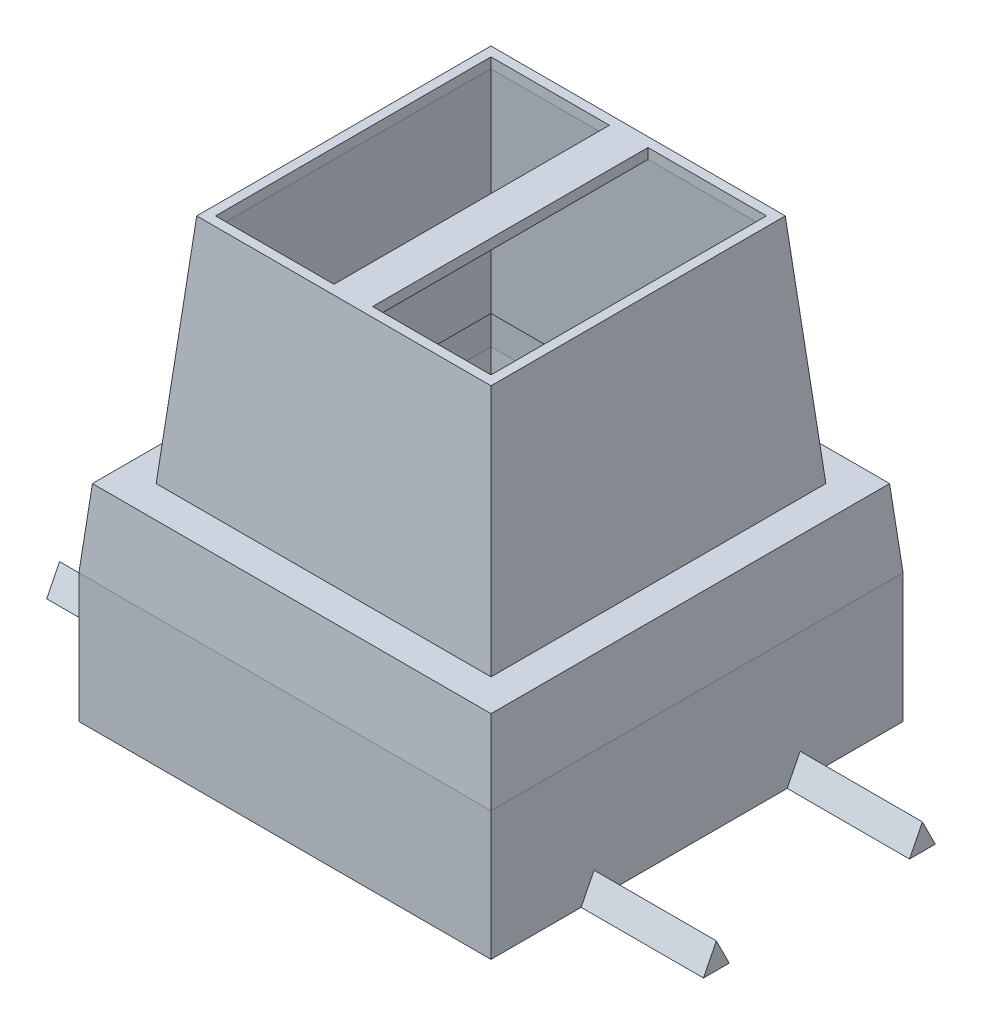
from build123d import *

# Parameters (mm, degrees)
SKETCH1_W           = 32
SKETCH1_H           = 32
BOSS_EXTRUDE1_DEPTH = 6
BOSS_EXTRUDE1_TAPER = 5
SKETCH2_W           = 26
SKETCH2_H           = 26
BOSS_EXTRUDE2_DEPTH = 18
BOSS_EXTRUDE2_TAPER = 5
SHELL1_T            = -0.8
CHAMFER1_SIZE       = 2.5
CHAMFER1_SIZE_2     = 2.750157169
SKETCH3_W           = 9.192139117
SKETCH3_H           = 21.384278234
CUT_EXTRUDE1_DEPTH  = 51.855088412
SKETCH4_W           = 32
SKETCH4_H           = 32
SKETCH4_W_2         = 30.39388826
SKETCH4_H_2         = 30.39388826
BOSS_EXTRUDE3_DEPTH = 10
BOSS_EXTRUDE4_DEPTH = 9.5
BOSS_EXTRUDE5_START = -32
BOSS_EXTRUDE5_DEPTH = 9.5


with BuildPart() as part:
    # Sketch1 → Boss-Extrude1 (new body)
    with BuildSketch(Plane(origin=(0, 0, 0), x_dir=(1, 0, 0), z_dir=(0, 1, 0))):
        with Locations((-16, 16)):
            Rectangle(SKETCH1_W, SKETCH1_H)
    extrude(amount=BOSS_EXTRUDE1_DEPTH, taper=BOSS_EXTRUDE1_TAPER)

    # Sketch2 → Boss-Extrude2 (add)
    with BuildSketch(Plane(origin=(0, 6, 0), x_dir=(1, 0, 0), z_dir=(0, 1, 0))):
        with Locations((-16, 16)):
            Rectangle(SKETCH2_W, SKETCH2_H)
    extrude(amount=BOSS_EXTRUDE2_DEPTH, taper=BOSS_EXTRUDE2_TAPER)

    # Shell1
    shell1_openings = [part.faces().sort_by_distance(p)[0] for p in [
        (-16, 0, -16),
    ]]
    offset(amount=SHELL1_T, openings=shell1_openings, kind=Kind.INTERSECTION)

    # Chamfer1
    # the kernel refuses this chamfer: 2.750157169, 2.5 mm, written as the material it adds along each edge
    with BuildSketch(Plane(origin=(5.830274952, 5.2, -1.25799692), x_dir=(0, 0.030161850139926293, -0.9995450278982617), z_dir=(-1, 0, 0))) as chamfer1_piece_1_section:
        Polygon((CHAMFER1_SIZE * 0.999545027898, CHAMFER1_SIZE * 0.0301618501399), (-CHAMFER1_SIZE_2 * 0.117163164513, CHAMFER1_SIZE_2 * 0.993112678869), (0, 0), align=None)
    chamfer1_piece_1 = extrude(amount=43.660549905, mode=Mode.PRIVATE)
    chamfer1_piece_1 = split(chamfer1_piece_1, bisect_by=Plane(origin=(-1.2737044, 5.379537315, -3.779154262), z_dir=(-0.9961946980917455, -0.08715574274765792, 0)), keep=Keep.TOP, mode=Mode.PRIVATE)
    chamfer1_piece_1 = split(chamfer1_piece_1, bisect_by=Plane(origin=(-3.729971497, 5.164641789, -3.779154262), z_dir=(0.9961946980917455, 0.08715574274765821, 0)), keep=Keep.TOP, mode=Mode.PRIVATE)
    chamfer1_piece_1 = split(chamfer1_piece_1, bisect_by=Plane(origin=(-2.501837948, 5.275543614, -3.739674149), z_dir=(0, -0.08715574274765829, -0.9961946980917455)), keep=Keep.TOP, mode=Mode.PRIVATE)
    add(chamfer1_piece_1)
    with BuildSketch(Plane(origin=(5.830274952, 5.2, -1.25799692), x_dir=(0, 0.030161850139926293, -0.9995450278982617), z_dir=(-1, 0, 0))) as chamfer1_piece_2_section:
        Polygon((CHAMFER1_SIZE * 0.999545027898, CHAMFER1_SIZE * 0.0301618501399), (-CHAMFER1_SIZE_2 * 0.117163164513, CHAMFER1_SIZE_2 * 0.993112678869), (0, 0), align=None)
    chamfer1_piece_2 = extrude(amount=43.660549905, mode=Mode.PRIVATE)
    chamfer1_piece_2 = split(chamfer1_piece_2, bisect_by=Plane(origin=(-1.187972058, 4.399612159, -1.99521412), z_dir=(-0.9961946980917455, -0.08715574274765792, 0)), keep=Keep.TOP, mode=Mode.PRIVATE)
    chamfer1_piece_2 = split(chamfer1_piece_2, bisect_by=Plane(origin=(-3.644239154, 4.184716633, -1.99521412), z_dir=(0.9961946980917455, 0.08715574274765821, 0)), keep=Keep.TOP, mode=Mode.PRIVATE)
    chamfer1_piece_2 = split(chamfer1_piece_2, bisect_by=Plane(origin=(-2.416105606, 4.148173113, -3.641042011), z_dir=(0, 0.08715574274765829, 0.9961946980917455)), keep=Keep.TOP, mode=Mode.PRIVATE)
    add(chamfer1_piece_2)
    with BuildSketch(Plane(origin=(5.830274952, 5.2, -1.25799692), x_dir=(0, 0.030161850139926293, -0.9995450278982617), z_dir=(-1, 0, 0))) as chamfer1_piece_3_section:
        Polygon((CHAMFER1_SIZE * 0.999545027898, CHAMFER1_SIZE * 0.0301618501399), (-CHAMFER1_SIZE_2 * 0.117163164513, CHAMFER1_SIZE_2 * 0.993112678869), (0, 0), align=None)
    chamfer1_piece_3 = extrude(amount=43.660549905, mode=Mode.PRIVATE)
    chamfer1_piece_3 = split(chamfer1_piece_3, bisect_by=Plane(origin=(-3.747130429, 5.360769289, -1.993289961), z_dir=(-0.9961946980917455, -0.08715574274765821, 0)), keep=Keep.TOP, mode=Mode.PRIVATE)
    chamfer1_piece_3 = split(chamfer1_piece_3, bisect_by=Plane(origin=(-16, 4.144649452, -3.64073373), z_dir=(0, 0.08715574274765829, 0.9961946980917455)), keep=Keep.TOP, mode=Mode.PRIVATE)
    chamfer1_piece_3 = split(chamfer1_piece_3, bisect_by=Plane(origin=(-28.252869571, 5.360769289, -1.993289961), z_dir=(0.9961946980917455, -0.08715574274765829, 0)), keep=Keep.TOP, mode=Mode.PRIVATE)
    add(chamfer1_piece_3)
    with BuildSketch(Plane(origin=(5.830274952, 5.2, -1.25799692), x_dir=(0, 0.030161850139926293, -0.9995450278982617), z_dir=(-1, 0, 0))) as chamfer1_piece_4_section:
        Polygon((CHAMFER1_SIZE * 0.999545027898, CHAMFER1_SIZE * 0.0301618501399), (-CHAMFER1_SIZE_2 * 0.117163164513, CHAMFER1_SIZE_2 * 0.993112678869), (0, 0), align=None)
    chamfer1_piece_4 = extrude(amount=43.660549905, mode=Mode.PRIVATE)
    chamfer1_piece_4 = split(chamfer1_piece_4, bisect_by=Plane(origin=(-29.498162052, 5.275543614, -3.739674149), z_dir=(0, -0.08715574274765829, -0.9961946980917455)), keep=Keep.TOP, mode=Mode.PRIVATE)
    chamfer1_piece_4 = split(chamfer1_piece_4, bisect_by=Plane(origin=(-28.270028503, 5.164641789, -3.779154262), z_dir=(-0.9961946980917455, 0.08715574274765829, 0)), keep=Keep.TOP, mode=Mode.PRIVATE)
    chamfer1_piece_4 = split(chamfer1_piece_4, bisect_by=Plane(origin=(-30.7262956, 5.379537315, -3.779154262), z_dir=(0.9961946980917455, -0.08715574274765851, 0)), keep=Keep.TOP, mode=Mode.PRIVATE)
    add(chamfer1_piece_4)
    with BuildSketch(Plane(origin=(5.830274952, 5.2, -1.25799692), x_dir=(0, 0.030161850139926293, -0.9995450278982617), z_dir=(-1, 0, 0))) as chamfer1_piece_5_section:
        Polygon((CHAMFER1_SIZE * 0.999545027898, CHAMFER1_SIZE * 0.0301618501399), (-CHAMFER1_SIZE_2 * 0.117163164513, CHAMFER1_SIZE_2 * 0.993112678869), (0, 0), align=None)
    chamfer1_piece_5 = extrude(amount=43.660549905, mode=Mode.PRIVATE)
    chamfer1_piece_5 = split(chamfer1_piece_5, bisect_by=Plane(origin=(-29.583894394, 4.148173113, -3.641042011), z_dir=(0, 0.08715574274765829, 0.9961946980917455)), keep=Keep.TOP, mode=Mode.PRIVATE)
    chamfer1_piece_5 = split(chamfer1_piece_5, bisect_by=Plane(origin=(-28.355760846, 4.184716633, -1.99521412), z_dir=(-0.9961946980917455, 0.08715574274765829, 0)), keep=Keep.TOP, mode=Mode.PRIVATE)
    chamfer1_piece_5 = split(chamfer1_piece_5, bisect_by=Plane(origin=(-30.812027942, 4.399612159, -1.99521412), z_dir=(0.9961946980917455, -0.08715574274765851, 0)), keep=Keep.TOP, mode=Mode.PRIVATE)
    add(chamfer1_piece_5)
    with BuildSketch(Plane(origin=(-30.74200308, 5.2, 5.830274952), x_dir=(0.9995450278982617, 0.030161850139926356, 0), z_dir=(0, 0, -1))) as chamfer1_piece_6_section:
        Polygon((CHAMFER1_SIZE * 0.999545027898, CHAMFER1_SIZE * 0.0301618501399), (-CHAMFER1_SIZE_2 * 0.117163164513, CHAMFER1_SIZE_2 * 0.993112678869), (0, 0), align=None)
    chamfer1_piece_6 = extrude(amount=43.660549905, mode=Mode.PRIVATE)
    chamfer1_piece_6 = split(chamfer1_piece_6, bisect_by=Plane(origin=(-28.220845738, 5.164641789, -3.729971497), z_dir=(0, 0.08715574274765829, 0.9961946980917455)), keep=Keep.TOP, mode=Mode.PRIVATE)
    chamfer1_piece_6 = split(chamfer1_piece_6, bisect_by=Plane(origin=(-28.260325851, 5.275543614, -2.501837948), z_dir=(0.9961946980917455, -0.08715574274765829, 0)), keep=Keep.TOP, mode=Mode.PRIVATE)
    chamfer1_piece_6 = split(chamfer1_piece_6, bisect_by=Plane(origin=(-28.220845738, 5.379537315, -1.2737044), z_dir=(0, -0.08715574274765792, -0.9961946980917455)), keep=Keep.TOP, mode=Mode.PRIVATE)
    add(chamfer1_piece_6)
    with BuildSketch(Plane(origin=(-30.74200308, 5.2, 5.830274952), x_dir=(0.9995450278982617, 0.030161850139926356, 0), z_dir=(0, 0, -1))) as chamfer1_piece_7_section:
        Polygon((CHAMFER1_SIZE * 0.999545027898, CHAMFER1_SIZE * 0.0301618501399), (-CHAMFER1_SIZE_2 * 0.117163164513, CHAMFER1_SIZE_2 * 0.993112678869), (0, 0), align=None)
    chamfer1_piece_7 = extrude(amount=43.660549905, mode=Mode.PRIVATE)
    chamfer1_piece_7 = split(chamfer1_piece_7, bisect_by=Plane(origin=(-30.00478588, 4.184716633, -3.644239154), z_dir=(0, 0.08715574274765829, 0.9961946980917455)), keep=Keep.TOP, mode=Mode.PRIVATE)
    chamfer1_piece_7 = split(chamfer1_piece_7, bisect_by=Plane(origin=(-28.358957989, 4.148173113, -2.416105606), z_dir=(-0.9961946980917455, 0.08715574274765829, 0)), keep=Keep.TOP, mode=Mode.PRIVATE)
    chamfer1_piece_7 = split(chamfer1_piece_7, bisect_by=Plane(origin=(-30.00478588, 4.399612159, -1.187972058), z_dir=(0, -0.08715574274765792, -0.9961946980917455)), keep=Keep.TOP, mode=Mode.PRIVATE)
    add(chamfer1_piece_7)
    with BuildSketch(Plane(origin=(-30.74200308, 5.2, 5.830274952), x_dir=(0.9995450278982617, 0.030161850139926356, 0), z_dir=(0, 0, -1))) as chamfer1_piece_8_section:
        Polygon((CHAMFER1_SIZE * 0.999545027898, CHAMFER1_SIZE * 0.0301618501399), (-CHAMFER1_SIZE_2 * 0.117163164513, CHAMFER1_SIZE_2 * 0.993112678869), (0, 0), align=None)
    chamfer1_piece_8 = extrude(amount=43.660549905, mode=Mode.PRIVATE)
    chamfer1_piece_8 = split(chamfer1_piece_8, bisect_by=Plane(origin=(-30.006710039, 5.360769289, -28.252869571), z_dir=(0, -0.08715574274765829, 0.9961946980917455)), keep=Keep.TOP, mode=Mode.PRIVATE)
    chamfer1_piece_8 = split(chamfer1_piece_8, bisect_by=Plane(origin=(-30.006710039, 5.360769289, -3.747130429), z_dir=(0, -0.08715574274765829, -0.9961946980917455)), keep=Keep.TOP, mode=Mode.PRIVATE)
    chamfer1_piece_8 = split(chamfer1_piece_8, bisect_by=Plane(origin=(-28.35926627, 4.144649452, -16), z_dir=(-0.9961946980917455, 0.08715574274765829, 0)), keep=Keep.TOP, mode=Mode.PRIVATE)
    add(chamfer1_piece_8)
    with BuildSketch(Plane(origin=(-30.74200308, 5.2, 5.830274952), x_dir=(0.9995450278982617, 0.030161850139926356, 0), z_dir=(0, 0, -1))) as chamfer1_piece_9_section:
        Polygon((CHAMFER1_SIZE * 0.999545027898, CHAMFER1_SIZE * 0.0301618501399), (-CHAMFER1_SIZE_2 * 0.117163164513, CHAMFER1_SIZE_2 * 0.993112678869), (0, 0), align=None)
    chamfer1_piece_9 = extrude(amount=43.660549905, mode=Mode.PRIVATE)
    chamfer1_piece_9 = split(chamfer1_piece_9, bisect_by=Plane(origin=(-28.220845738, 5.379537315, -30.7262956), z_dir=(0, -0.08715574274765836, 0.9961946980917455)), keep=Keep.TOP, mode=Mode.PRIVATE)
    chamfer1_piece_9 = split(chamfer1_piece_9, bisect_by=Plane(origin=(-28.220845738, 5.164641789, -28.270028503), z_dir=(0, 0.08715574274765829, -0.9961946980917455)), keep=Keep.TOP, mode=Mode.PRIVATE)
    chamfer1_piece_9 = split(chamfer1_piece_9, bisect_by=Plane(origin=(-28.260325851, 5.275543614, -29.498162052), z_dir=(0.9961946980917455, -0.08715574274765829, 0)), keep=Keep.TOP, mode=Mode.PRIVATE)
    add(chamfer1_piece_9)
    with BuildSketch(Plane(origin=(-30.74200308, 5.2, 5.830274952), x_dir=(0.9995450278982617, 0.030161850139926356, 0), z_dir=(0, 0, -1))) as chamfer1_piece_10_section:
        Polygon((CHAMFER1_SIZE * 0.999545027898, CHAMFER1_SIZE * 0.0301618501399), (-CHAMFER1_SIZE_2 * 0.117163164513, CHAMFER1_SIZE_2 * 0.993112678869), (0, 0), align=None)
    chamfer1_piece_10 = extrude(amount=43.660549905, mode=Mode.PRIVATE)
    chamfer1_piece_10 = split(chamfer1_piece_10, bisect_by=Plane(origin=(-30.00478588, 4.399612159, -30.812027942), z_dir=(0, -0.08715574274765836, 0.9961946980917455)), keep=Keep.TOP, mode=Mode.PRIVATE)
    chamfer1_piece_10 = split(chamfer1_piece_10, bisect_by=Plane(origin=(-30.00478588, 4.184716633, -28.355760846), z_dir=(0, 0.08715574274765829, -0.9961946980917455)), keep=Keep.TOP, mode=Mode.PRIVATE)
    chamfer1_piece_10 = split(chamfer1_piece_10, bisect_by=Plane(origin=(-28.358957989, 4.148173113, -29.583894394), z_dir=(-0.9961946980917455, 0.08715574274765829, 0)), keep=Keep.TOP, mode=Mode.PRIVATE)
    add(chamfer1_piece_10)
    with BuildSketch(Plane(origin=(5.830274952, 5.2, -30.74200308), x_dir=(0, -0.9937112432628153, -0.11197305485280758), z_dir=(-1, 0, 0))) as chamfer1_piece_11_section:
        Polygon((CHAMFER1_SIZE_2 * 0.99968896676, CHAMFER1_SIZE_2 * 0.0249393220908), (-CHAMFER1_SIZE * 0.111973054853, CHAMFER1_SIZE * 0.993711243263), (0, 0), align=None)
    chamfer1_piece_11 = extrude(amount=43.660549905, mode=Mode.PRIVATE)
    chamfer1_piece_11 = split(chamfer1_piece_11, bisect_by=Plane(origin=(-1.187972058, 4.399612159, -30.00478588), z_dir=(-0.9961946980917455, -0.08715574274765792, 0)), keep=Keep.TOP, mode=Mode.PRIVATE)
    chamfer1_piece_11 = split(chamfer1_piece_11, bisect_by=Plane(origin=(-2.416105606, 4.148173113, -28.358957989), z_dir=(0, 0.08715574274765829, -0.9961946980917455)), keep=Keep.TOP, mode=Mode.PRIVATE)
    chamfer1_piece_11 = split(chamfer1_piece_11, bisect_by=Plane(origin=(-3.644239154, 4.184716633, -30.00478588), z_dir=(0.9961946980917455, 0.08715574274765821, 0)), keep=Keep.TOP, mode=Mode.PRIVATE)
    add(chamfer1_piece_11)
    with BuildSketch(Plane(origin=(5.830274952, 5.2, -30.74200308), x_dir=(0, -0.9937112432628153, -0.11197305485280758), z_dir=(-1, 0, 0))) as chamfer1_piece_12_section:
        Polygon((CHAMFER1_SIZE_2 * 0.99968896676, CHAMFER1_SIZE_2 * 0.0249393220908), (-CHAMFER1_SIZE * 0.111973054853, CHAMFER1_SIZE * 0.993711243263), (0, 0), align=None)
    chamfer1_piece_12 = extrude(amount=43.660549905, mode=Mode.PRIVATE)
    chamfer1_piece_12 = split(chamfer1_piece_12, bisect_by=Plane(origin=(-1.2737044, 5.379537315, -28.220845738), z_dir=(-0.9961946980917455, -0.08715574274765792, 0)), keep=Keep.TOP, mode=Mode.PRIVATE)
    chamfer1_piece_12 = split(chamfer1_piece_12, bisect_by=Plane(origin=(-2.501837948, 5.275543614, -28.260325851), z_dir=(0, -0.08715574274765829, 0.9961946980917455)), keep=Keep.TOP, mode=Mode.PRIVATE)
    chamfer1_piece_12 = split(chamfer1_piece_12, bisect_by=Plane(origin=(-3.729971497, 5.164641789, -28.220845738), z_dir=(0.9961946980917455, 0.08715574274765821, 0)), keep=Keep.TOP, mode=Mode.PRIVATE)
    add(chamfer1_piece_12)
    with BuildSketch(Plane(origin=(5.830274952, 5.2, -30.74200308), x_dir=(0, -0.9937112432628153, -0.11197305485280758), z_dir=(-1, 0, 0))) as chamfer1_piece_13_section:
        Polygon((CHAMFER1_SIZE_2 * 0.99968896676, CHAMFER1_SIZE_2 * 0.0249393220908), (-CHAMFER1_SIZE * 0.111973054853, CHAMFER1_SIZE * 0.993711243263), (0, 0), align=None)
    chamfer1_piece_13 = extrude(amount=43.660549905, mode=Mode.PRIVATE)
    chamfer1_piece_13 = split(chamfer1_piece_13, bisect_by=Plane(origin=(-16, 4.144649452, -28.35926627), z_dir=(0, 0.08715574274765829, -0.9961946980917455)), keep=Keep.TOP, mode=Mode.PRIVATE)
    chamfer1_piece_13 = split(chamfer1_piece_13, bisect_by=Plane(origin=(-3.747130429, 5.360769289, -30.006710039), z_dir=(-0.9961946980917455, -0.08715574274765821, 0)), keep=Keep.TOP, mode=Mode.PRIVATE)
    chamfer1_piece_13 = split(chamfer1_piece_13, bisect_by=Plane(origin=(-28.252869571, 5.360769289, -30.006710039), z_dir=(0.9961946980917455, -0.08715574274765829, 0)), keep=Keep.TOP, mode=Mode.PRIVATE)
    add(chamfer1_piece_13)
    with BuildSketch(Plane(origin=(5.830274952, 5.2, -30.74200308), x_dir=(0, -0.9937112432628153, -0.11197305485280758), z_dir=(-1, 0, 0))) as chamfer1_piece_14_section:
        Polygon((CHAMFER1_SIZE_2 * 0.99968896676, CHAMFER1_SIZE_2 * 0.0249393220908), (-CHAMFER1_SIZE * 0.111973054853, CHAMFER1_SIZE * 0.993711243263), (0, 0), align=None)
    chamfer1_piece_14 = extrude(amount=43.660549905, mode=Mode.PRIVATE)
    chamfer1_piece_14 = split(chamfer1_piece_14, bisect_by=Plane(origin=(-30.812027942, 4.399612159, -30.00478588), z_dir=(0.9961946980917455, -0.08715574274765851, 0)), keep=Keep.TOP, mode=Mode.PRIVATE)
    chamfer1_piece_14 = split(chamfer1_piece_14, bisect_by=Plane(origin=(-29.583894394, 4.148173113, -28.358957989), z_dir=(0, 0.08715574274765829, -0.9961946980917455)), keep=Keep.TOP, mode=Mode.PRIVATE)
    chamfer1_piece_14 = split(chamfer1_piece_14, bisect_by=Plane(origin=(-28.355760846, 4.184716633, -30.00478588), z_dir=(-0.9961946980917455, 0.08715574274765829, 0)), keep=Keep.TOP, mode=Mode.PRIVATE)
    add(chamfer1_piece_14)
    with BuildSketch(Plane(origin=(5.830274952, 5.2, -30.74200308), x_dir=(0, -0.9937112432628153, -0.11197305485280758), z_dir=(-1, 0, 0))) as chamfer1_piece_15_section:
        Polygon((CHAMFER1_SIZE_2 * 0.99968896676, CHAMFER1_SIZE_2 * 0.0249393220908), (-CHAMFER1_SIZE * 0.111973054853, CHAMFER1_SIZE * 0.993711243263), (0, 0), align=None)
    chamfer1_piece_15 = extrude(amount=43.660549905, mode=Mode.PRIVATE)
    chamfer1_piece_15 = split(chamfer1_piece_15, bisect_by=Plane(origin=(-30.7262956, 5.379537315, -28.220845738), z_dir=(0.9961946980917455, -0.08715574274765851, 0)), keep=Keep.TOP, mode=Mode.PRIVATE)
    chamfer1_piece_15 = split(chamfer1_piece_15, bisect_by=Plane(origin=(-29.498162052, 5.275543614, -28.260325851), z_dir=(0, -0.08715574274765829, 0.9961946980917455)), keep=Keep.TOP, mode=Mode.PRIVATE)
    chamfer1_piece_15 = split(chamfer1_piece_15, bisect_by=Plane(origin=(-28.270028503, 5.164641789, -28.220845738), z_dir=(-0.9961946980917455, 0.08715574274765829, 0)), keep=Keep.TOP, mode=Mode.PRIVATE)
    add(chamfer1_piece_15)
    with BuildSketch(Plane(origin=(-1.25799692, 5.2, 5.830274952), x_dir=(0.11197305485280797, -0.9937112432628151, 0), z_dir=(0, 0, -1))) as chamfer1_piece_16_section:
        Polygon((CHAMFER1_SIZE_2 * 0.99968896676, CHAMFER1_SIZE_2 * 0.0249393220908), (-CHAMFER1_SIZE * 0.111973054853, CHAMFER1_SIZE * 0.993711243263), (0, 0), align=None)
    chamfer1_piece_16 = extrude(amount=43.660549905, mode=Mode.PRIVATE)
    chamfer1_piece_16 = split(chamfer1_piece_16, bisect_by=Plane(origin=(-1.99521412, 4.399612159, -1.187972058), z_dir=(0, -0.08715574274765792, -0.9961946980917455)), keep=Keep.TOP, mode=Mode.PRIVATE)
    chamfer1_piece_16 = split(chamfer1_piece_16, bisect_by=Plane(origin=(-3.641042011, 4.148173113, -2.416105606), z_dir=(0.9961946980917455, 0.08715574274765821, 0)), keep=Keep.TOP, mode=Mode.PRIVATE)
    chamfer1_piece_16 = split(chamfer1_piece_16, bisect_by=Plane(origin=(-1.99521412, 4.184716633, -3.644239154), z_dir=(0, 0.08715574274765829, 0.9961946980917455)), keep=Keep.TOP, mode=Mode.PRIVATE)
    add(chamfer1_piece_16)
    with BuildSketch(Plane(origin=(-1.25799692, 5.2, 5.830274952), x_dir=(0.11197305485280797, -0.9937112432628151, 0), z_dir=(0, 0, -1))) as chamfer1_piece_17_section:
        Polygon((CHAMFER1_SIZE_2 * 0.99968896676, CHAMFER1_SIZE_2 * 0.0249393220908), (-CHAMFER1_SIZE * 0.111973054853, CHAMFER1_SIZE * 0.993711243263), (0, 0), align=None)
    chamfer1_piece_17 = extrude(amount=43.660549905, mode=Mode.PRIVATE)
    chamfer1_piece_17 = split(chamfer1_piece_17, bisect_by=Plane(origin=(-3.779154262, 5.379537315, -1.2737044), z_dir=(0, -0.08715574274765792, -0.9961946980917455)), keep=Keep.TOP, mode=Mode.PRIVATE)
    chamfer1_piece_17 = split(chamfer1_piece_17, bisect_by=Plane(origin=(-3.739674149, 5.275543614, -2.501837948), z_dir=(-0.9961946980917455, -0.08715574274765821, 0)), keep=Keep.TOP, mode=Mode.PRIVATE)
    chamfer1_piece_17 = split(chamfer1_piece_17, bisect_by=Plane(origin=(-3.779154262, 5.164641789, -3.729971497), z_dir=(0, 0.08715574274765829, 0.9961946980917455)), keep=Keep.TOP, mode=Mode.PRIVATE)
    add(chamfer1_piece_17)
    with BuildSketch(Plane(origin=(-1.25799692, 5.2, 5.830274952), x_dir=(0.11197305485280797, -0.9937112432628151, 0), z_dir=(0, 0, -1))) as chamfer1_piece_18_section:
        Polygon((CHAMFER1_SIZE_2 * 0.99968896676, CHAMFER1_SIZE_2 * 0.0249393220908), (-CHAMFER1_SIZE * 0.111973054853, CHAMFER1_SIZE * 0.993711243263), (0, 0), align=None)
    chamfer1_piece_18 = extrude(amount=43.660549905, mode=Mode.PRIVATE)
    chamfer1_piece_18 = split(chamfer1_piece_18, bisect_by=Plane(origin=(-1.993289961, 5.360769289, -28.252869571), z_dir=(0, -0.08715574274765829, 0.9961946980917455)), keep=Keep.TOP, mode=Mode.PRIVATE)
    chamfer1_piece_18 = split(chamfer1_piece_18, bisect_by=Plane(origin=(-3.64073373, 4.144649452, -16), z_dir=(0.9961946980917455, 0.08715574274765821, 0)), keep=Keep.TOP, mode=Mode.PRIVATE)
    chamfer1_piece_18 = split(chamfer1_piece_18, bisect_by=Plane(origin=(-1.993289961, 5.360769289, -3.747130429), z_dir=(0, -0.08715574274765829, -0.9961946980917455)), keep=Keep.TOP, mode=Mode.PRIVATE)
    add(chamfer1_piece_18)
    with BuildSketch(Plane(origin=(-1.25799692, 5.2, 5.830274952), x_dir=(0.11197305485280797, -0.9937112432628151, 0), z_dir=(0, 0, -1))) as chamfer1_piece_19_section:
        Polygon((CHAMFER1_SIZE_2 * 0.99968896676, CHAMFER1_SIZE_2 * 0.0249393220908), (-CHAMFER1_SIZE * 0.111973054853, CHAMFER1_SIZE * 0.993711243263), (0, 0), align=None)
    chamfer1_piece_19 = extrude(amount=43.660549905, mode=Mode.PRIVATE)
    chamfer1_piece_19 = split(chamfer1_piece_19, bisect_by=Plane(origin=(-1.99521412, 4.399612159, -30.812027942), z_dir=(0, -0.08715574274765836, 0.9961946980917455)), keep=Keep.TOP, mode=Mode.PRIVATE)
    chamfer1_piece_19 = split(chamfer1_piece_19, bisect_by=Plane(origin=(-1.99521412, 4.184716633, -28.355760846), z_dir=(0, 0.08715574274765829, -0.9961946980917455)), keep=Keep.TOP, mode=Mode.PRIVATE)
    chamfer1_piece_19 = split(chamfer1_piece_19, bisect_by=Plane(origin=(-3.641042011, 4.148173113, -29.583894394), z_dir=(0.9961946980917455, 0.08715574274765821, 0)), keep=Keep.TOP, mode=Mode.PRIVATE)
    add(chamfer1_piece_19)
    with BuildSketch(Plane(origin=(-1.25799692, 5.2, 5.830274952), x_dir=(0.11197305485280797, -0.9937112432628151, 0), z_dir=(0, 0, -1))) as chamfer1_piece_20_section:
        Polygon((CHAMFER1_SIZE_2 * 0.99968896676, CHAMFER1_SIZE_2 * 0.0249393220908), (-CHAMFER1_SIZE * 0.111973054853, CHAMFER1_SIZE * 0.993711243263), (0, 0), align=None)
    chamfer1_piece_20 = extrude(amount=43.660549905, mode=Mode.PRIVATE)
    chamfer1_piece_20 = split(chamfer1_piece_20, bisect_by=Plane(origin=(-3.779154262, 5.379537315, -30.7262956), z_dir=(0, -0.08715574274765836, 0.9961946980917455)), keep=Keep.TOP, mode=Mode.PRIVATE)
    chamfer1_piece_20 = split(chamfer1_piece_20, bisect_by=Plane(origin=(-3.779154262, 5.164641789, -28.270028503), z_dir=(0, 0.08715574274765829, -0.9961946980917455)), keep=Keep.TOP, mode=Mode.PRIVATE)
    chamfer1_piece_20 = split(chamfer1_piece_20, bisect_by=Plane(origin=(-3.739674149, 5.275543614, -29.498162052), z_dir=(-0.9961946980917455, -0.08715574274765821, 0)), keep=Keep.TOP, mode=Mode.PRIVATE)
    add(chamfer1_piece_20)

    # Sketch3 → Cut-Extrude1 (cut, through all)
    with BuildSketch(Plane.XZ.offset(-23.2)):
        with Locations((-22.096069558, -16)):
            Rectangle(SKETCH3_W, SKETCH3_H)
        with Locations((-9.903930442, -16)):
            Rectangle(SKETCH3_W, SKETCH3_H)
    extrude(amount=-CUT_EXTRUDE1_DEPTH, mode=Mode.SUBTRACT)

    # Sketch4 → Boss-Extrude3 (add)
    with BuildSketch(Plane.XZ):
        with Locations((-16, -16)):
            Rectangle(SKETCH4_W, SKETCH4_H)
        with Locations((-16, -16)):
            Rectangle(SKETCH4_W_2, SKETCH4_H_2, mode=Mode.SUBTRACT)
    extrude(amount=BOSS_EXTRUDE3_DEPTH)

    # Sketch5 → Boss-Extrude4 (add)
    with BuildSketch(Plane.ZY.offset(32)):
        Polygon((-24, -8), (-25, -10), (-23, -10), align=None)
        Polygon((-8, -8), (-9, -10), (-7, -10), align=None)
    extrude(amount=BOSS_EXTRUDE4_DEPTH)

    # Sketch5<3> → Boss-Extrude5 (add)
    with BuildSketch(Plane.ZY.offset(32).offset(BOSS_EXTRUDE5_START)):
        Polygon((-8, -8), (-9, -10), (-7, -10), align=None)
        Polygon((-24, -8), (-25, -10), (-23, -10), align=None)
    extrude(amount=-BOSS_EXTRUDE5_DEPTH)


solid = part.part
